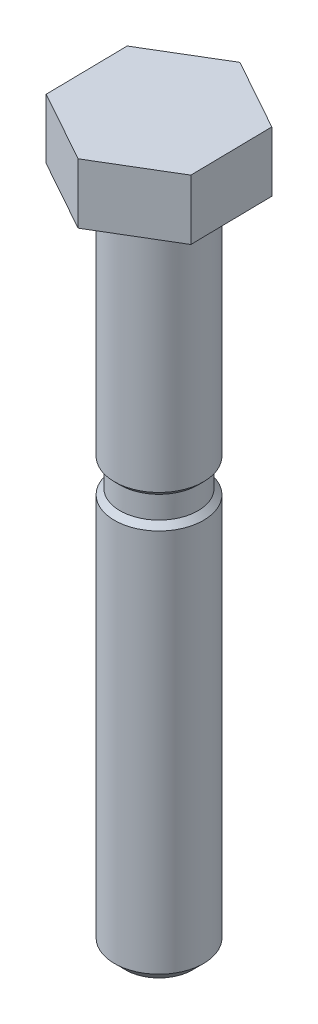
from build123d import *

# Parameters (mm, degrees)
BOSS_EXTRUDE1_DEPTH = 5.4
SKETCH3_R           = 4
BOSS_EXTRUDE2_DEPTH = 60
SKETCH4_R           = 4.399457614
SKETCH4_R_2         = 3.503217006
CUT_EXTRUDE1_DEPTH  = 1
CHAMFER1_SIZE       = 0.5
CHAMFER2_SIZE       = 1


with BuildPart() as part:
    # Sketch1 → Boss-Extrude1 (new body)
    with BuildSketch(Plane(origin=(0, 0, 0), x_dir=(1, 0, 0), z_dir=(0, 1, 0))):
        Polygon((6.457637206, -3.593362639), (6.340761933, 3.795796549), (-0.116875273, 7.389159188), (-6.457637206, 3.593362639), (-6.340761933, -3.795796549), (0.116875273, -7.389159188), align=None)
    extrude(amount=BOSS_EXTRUDE1_DEPTH)

    # Sketch3 → Boss-Extrude2 (add)
    with BuildSketch(Plane.XZ):
        with Locations(Location((0, 0, 0), (0, 0, 90))):
            Circle(SKETCH3_R)
    extrude(amount=BOSS_EXTRUDE2_DEPTH)

    # Sketch4 → Cut-Extrude1 (cut, symmetric)
    with BuildSketch(Plane(origin=(0, -23, 0), x_dir=(-1, 0, 0), z_dir=(0, -1, 0))):
        Circle(SKETCH4_R)
        with Locations(Location((0, 0, 0), (0, 0, 90))):
            Circle(SKETCH4_R_2, mode=Mode.SUBTRACT)
    extrude(amount=CUT_EXTRUDE1_DEPTH, both=True, mode=Mode.SUBTRACT)

    # Chamfer1
    # the kernel refuses this chamfer: 0.5 mm, written as the material it takes off along each edge
    with BuildSketch(Plane(origin=(0, -22, 0), x_dir=(0, 0, 1), z_dir=(-1, 0, 0))) as chamfer1_piece_1_section:
        Polygon((4, CHAMFER1_SIZE), (4 - CHAMFER1_SIZE, 0), (4, 0), align=None)
    chamfer1_piece_1 = revolve(axis=Axis((0, -22, 0), (0, 1, 0)), mode=Mode.PRIVATE)
    chamfer1_piece_1 = chamfer1_piece_1 - Plane(origin=(0, -21.751856144, 0), x_dir=(0, 0, -1), z_dir=(0, 1, 0)) * Cylinder(3.503217006, 16, mode=Mode.PRIVATE)
    add(chamfer1_piece_1, mode=Mode.SUBTRACT)
    with BuildSketch(Plane(origin=(0, -24, 0), x_dir=(0, 0, 1), z_dir=(-1, 0, 0))) as chamfer1_piece_2_section:
        Polygon((4 - CHAMFER1_SIZE, 0), (4, -CHAMFER1_SIZE), (4, 0), align=None)
    chamfer1_piece_2 = revolve(axis=Axis((0, -24, 0), (0, 1, 0)), mode=Mode.PRIVATE)
    chamfer1_piece_2 = chamfer1_piece_2 - Plane(origin=(0, -24.248143856, 0), x_dir=(0, 0, -1), z_dir=(0, 1, 0)) * Cylinder(3.503217006, 16, mode=Mode.PRIVATE)
    add(chamfer1_piece_2, mode=Mode.SUBTRACT)

    # Chamfer2
    chamfer2_edges = [part.edges().sort_by_distance(p)[0] for p in [
        (0, -60, -4),
    ]]
    chamfer(chamfer2_edges, length=CHAMFER2_SIZE)


solid = part.part
